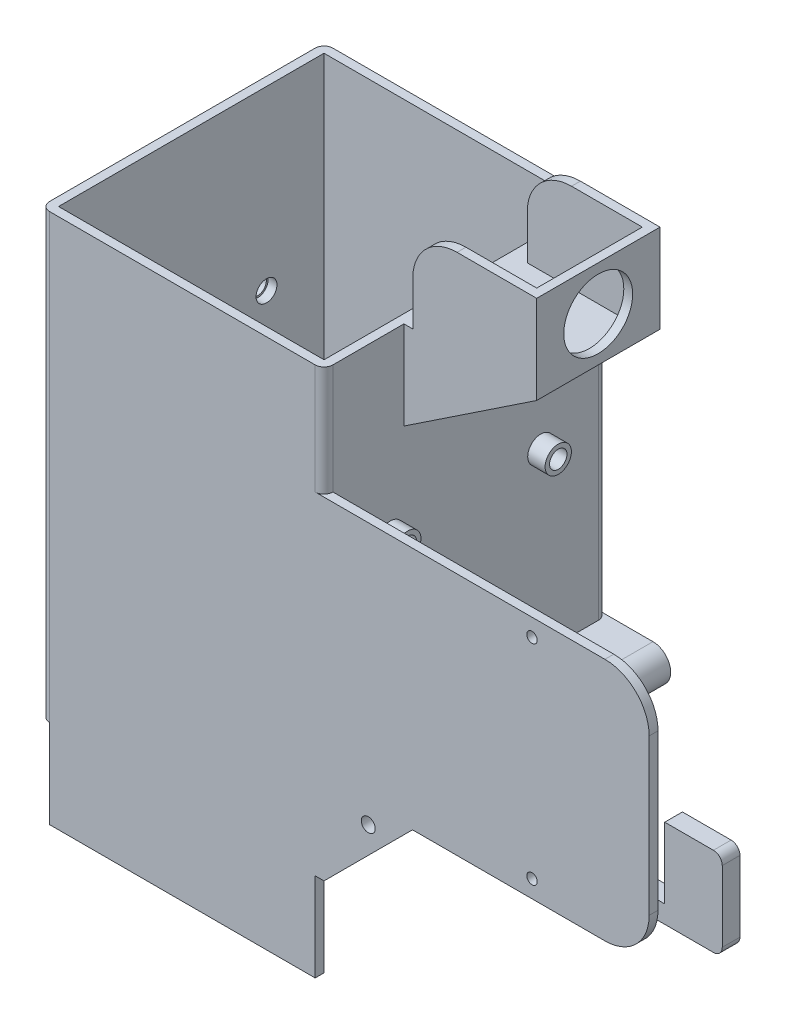
from build123d import *

# Parameters (mm, degrees)
SKETCH1_W            = 81.28
SKETCH1_H            = 81.28
SKETCH1_W_2          = 76.2
SKETCH1_H_2          = 76.2
BOSS_EXTRUDE1_DEPTH  = 177.8
SKETCH2_W            = 2.54
SKETCH2_H            = 38.1
BOSS_EXTRUDE2_DEPTH  = 25.4
SKETCH3_W            = 2.54
SKETCH3_H            = 25.4
CUT_EXTRUDE1_DEPTH   = 212.720846399
BOSS_EXTRUDE3_DEPTH  = 12.7
BOSS_EXTRUDE4_DEPTH  = 12.7
SKETCH14_W           = 5.08
SKETCH14_H           = 25.4
BOSS_EXTRUDE6_DEPTH  = 76.2
CUT_EXTRUDE2_REACH   = 243.407
SKETCH16_W           = 23.13
SKETCH16_H           = 20.32
SKETCH22_R           = 2
CUT_EXTRUDE6_DEPTH   = 252.036309724
SKETCH28_W           = 35.399999812
SKETCH28_H           = 50.8
BOSS_EXTRUDE7_DEPTH  = 38.1
CUT_EXTRUDE8_REACH   = 246.574
SKETCH32_W           = 33.02
SKETCH32_H           = 30.319999812
CUT_EXTRUDE9_DEPTH   = 25.4
CUT_EXTRUDE13_REACH  = 245.27
SKETCH34_R           = 9.890000016
BOSS_EXTRUDE9_DEPTH  = 2.54
SKETCH38_W           = 2.54
SKETCH38_H           = 25.4
CUT_EXTRUDE15_DEPTH  = 63.5
CUT_EXTRUDE17_REACH  = 224.71
SKETCH40_R           = 2.999995
SKETCH41_R           = 3.77
SKETCH41_R_2         = 2.5
BOSS_EXTRUDE10_DEPTH = 5
BOSS_EXTRUDE11_START = 5
SKETCH42_R           = 3.77
SKETCH42_R_2         = 2.5
BOSS_EXTRUDE11_DEPTH = 5
SKETCH43_W           = 76.2
SKETCH43_H           = 76.2
CUT_EXTRUDE20_DEPTH  = 25.4
SKETCH44_W           = 174.6
SKETCH44_H           = 70
SKETCH44_R           = 1.5
BOSS_EXTRUDE12_DEPTH = 2.54
FILLET1_R            = 5.08
FILLET2_R            = 12.7
FILLET3_R            = 2.54
FILLET7_R            = 12.7
FILLET9_R            = 12.7
BOSS_EXTRUDE20_DEPTH = 88.9
CUT_EXTRUDE21_REACH  = 275.109
SKETCH54_R           = 2.5
FILLET11_R           = 2.54
FILLET12_R           = 2.54


with BuildPart() as part:
    # Sketch1 → Boss-Extrude1 (new body)
    with BuildSketch(Plane(origin=(0, 0, 0), x_dir=(1, 0, 0), z_dir=(0, 1, 0))):
        with Locations((40.64, 40.64)):
            Rectangle(SKETCH1_W, SKETCH1_H)
        with Locations((40.64, 40.64)):
            Rectangle(SKETCH1_W_2, SKETCH1_H_2, mode=Mode.SUBTRACT)
    extrude(amount=BOSS_EXTRUDE1_DEPTH)

    # Sketch2 → Boss-Extrude2 (add)
    with BuildSketch(Plane(origin=(0, 0, 0), x_dir=(0, 0, -1), z_dir=(1, 0, 0))):
        with Locations((64.77, 19.05)):
            Rectangle(SKETCH2_W, SKETCH2_H)
    extrude(amount=-BOSS_EXTRUDE2_DEPTH)

    # Sketch3 → Cut-Extrude1 (cut, through all)
    with BuildSketch(Plane.XY):
        with Locations((80.01, 12.7)):
            Rectangle(SKETCH3_W, SKETCH3_H)
    extrude(amount=-CUT_EXTRUDE1_DEPTH, mode=Mode.SUBTRACT)

    # Sketch7 → Boss-Extrude3 (add)
    with BuildSketch(Plane.XY):
        Polygon((81.28, 25.4), (106.68, 50.8), (81.28, 50.8), align=None)
    extrude(amount=-BOSS_EXTRUDE3_DEPTH)

    # Sketch10 → Boss-Extrude4 (add)
    with BuildSketch(Plane(origin=(0, 0, -81.28), x_dir=(-1, 0, 0), z_dir=(0, 0, -1))):
        Polygon((-81.28, 25.4), (-81.28, 50.8), (-106.68, 50.8), align=None)
    extrude(amount=-BOSS_EXTRUDE4_DEPTH)

    # Sketch14 → Boss-Extrude6 (add)
    with BuildSketch(Plane(origin=(81.28, 0, 0), x_dir=(0, 0, -1), z_dir=(1, 0, 0))):
        with Locations((40.64, 38.1)):
            Rectangle(SKETCH14_W, SKETCH14_H)
    extrude(amount=BOSS_EXTRUDE6_DEPTH)

    # Sketch16 → Cut-Extrude2 (cut, up to next)
    with BuildSketch(Plane.XY.offset(-38.1), mode=Mode.PRIVATE) as cut_extrude2_sk1:
        with Locations((129.405, 40.64)):
            Rectangle(SKETCH16_W, SKETCH16_H)
    cut_extrude2_tool1 = extrude(cut_extrude2_sk1.sketch, amount=-CUT_EXTRUDE2_REACH, mode=Mode.PRIVATE) & part.part
    add(cut_extrude2_tool1.solids().sort_by_distance((129.405, 40.64, -38.1))[0], mode=Mode.SUBTRACT)

    # Sketch22 → Cut-Extrude6 (cut, through all)
    with BuildSketch(Plane.XY):
        with Locations((93.98, 45.72)):
            Circle(SKETCH22_R)
    extrude(amount=-CUT_EXTRUDE6_DEPTH, mode=Mode.SUBTRACT)

    # Sketch28 → Boss-Extrude7 (add)
    with BuildSketch(Plane(origin=(81.28, 0, 0), x_dir=(0, 0, -1), z_dir=(1, 0, 0))):
        with Locations((40.64, 152.4)):
            Rectangle(SKETCH28_W, SKETCH28_H)
    extrude(amount=BOSS_EXTRUDE7_DEPTH)

    # Sketch30 → Cut-Extrude8 (cut, up to next)
    with BuildSketch(Plane.XY.offset(-22.940000094), mode=Mode.PRIVATE) as cut_extrude8_sk1:
        Polygon((81.28, 127), (119.38, 127), (119.38, 152.4), align=None)
    cut_extrude8_tool1 = extrude(cut_extrude8_sk1.sketch, amount=-CUT_EXTRUDE8_REACH, mode=Mode.PRIVATE) & part.part
    add(cut_extrude8_tool1.solids().sort_by_distance((106.68, 135.466667, -22.94))[0], mode=Mode.SUBTRACT)

    # Sketch32 → Cut-Extrude9 (cut)
    with BuildSketch(Plane(origin=(0, 177.8, 0), x_dir=(1, 0, 0), z_dir=(0, 1, 0))):
        with Locations((100.33, 40.64)):
            Rectangle(SKETCH32_W, SKETCH32_H)
    extrude(amount=-CUT_EXTRUDE9_DEPTH, mode=Mode.SUBTRACT)

    # Cut-Extrude13: up to this face of the body (flat: up to its plane)
    cut_extrude13_end = Plane(part.part.faces().sort_by_distance((78.74, 101.6, -40.64))[0])
    # Sketch34 → Cut-Extrude13 (cut, up to the picked face)
    with BuildSketch(Plane(origin=(119.38, 0, 0), x_dir=(0, 0, -1), z_dir=(1, 0, 0)), mode=Mode.PRIVATE) as cut_extrude13_sk1:
        with Locations(Location((40.593000094, 165.1, 0), (0, 0, 180))):
            Circle(SKETCH34_R)
    cut_extrude13_tool1 = split(extrude(cut_extrude13_sk1.sketch, amount=-CUT_EXTRUDE13_REACH, mode=Mode.PRIVATE), bisect_by=cut_extrude13_end, keep=Keep.BOTH, mode=Mode.PRIVATE)
    add(cut_extrude13_tool1.solids().sort_by(Axis((119.38, 165.1, -40.593), (-1, 0, 0)))[0], mode=Mode.SUBTRACT)

    # Sketch37 → Boss-Extrude9 (add)
    with BuildSketch(Plane.XY.offset(-63.5)):
        Polygon((-25.4, 38.1), (0, 38.1), (0, 52.764696837), align=None)
    extrude(amount=-BOSS_EXTRUDE9_DEPTH)

    # Sketch38 → Cut-Extrude15 (cut)
    with BuildSketch(Plane.XY):
        with Locations((1.27, 12.7)):
            Rectangle(SKETCH38_W, SKETCH38_H)
    extrude(amount=-CUT_EXTRUDE15_DEPTH, mode=Mode.SUBTRACT)

    # Cut-Extrude17: up to this face of the body (flat: up to its plane)
    cut_extrude17_end = Plane(part.part.faces().sort_by_distance((0, 99.23335202, -41.514066738))[0])
    # Sketch40 → Cut-Extrude17 (cut, up to the picked face)
    with BuildSketch(Plane(origin=(81.28, 0, 0), x_dir=(0, 0, -1), z_dir=(1, 0, 0)), mode=Mode.PRIVATE) as cut_extrude17_sk1:
        with Locations((19.05, 101.6)):
            Circle(SKETCH40_R)
    cut_extrude17_tool1 = split(extrude(cut_extrude17_sk1.sketch, amount=-CUT_EXTRUDE17_REACH, mode=Mode.PRIVATE), bisect_by=cut_extrude17_end, keep=Keep.BOTH, mode=Mode.PRIVATE)
    # Sketch40 → Cut-Extrude17 (cut, up to the picked face)
    with BuildSketch(Plane(origin=(81.28, 0, 0), x_dir=(0, 0, -1), z_dir=(1, 0, 0)), mode=Mode.PRIVATE) as cut_extrude17_sk2:
        with Locations((62.23, 101.6)):
            Circle(SKETCH40_R)
    cut_extrude17_tool2 = split(extrude(cut_extrude17_sk2.sketch, amount=-CUT_EXTRUDE17_REACH, mode=Mode.PRIVATE), bisect_by=cut_extrude17_end, keep=Keep.BOTH, mode=Mode.PRIVATE)
    add(cut_extrude17_tool1.solids().sort_by(Axis((81.28, 101.6, -19.05), (-1, 0, 0)))[0], mode=Mode.SUBTRACT)
    add(cut_extrude17_tool2.solids().sort_by(Axis((81.28, 101.6, -62.23), (-1, 0, 0)))[0], mode=Mode.SUBTRACT)

    # Sketch41 → Boss-Extrude10 (add)
    # profile 1 of 2: a face of its own
    with BuildSketch(Plane(origin=(81.28, 0, 0), x_dir=(0, 0, -1), z_dir=(1, 0, 0))):
        with Locations(Location((19.05, 101.6, 0), (0, 0, 180))):
            Circle(SKETCH41_R)
        with Locations((19.05, 101.6)):
            Circle(SKETCH41_R_2, mode=Mode.SUBTRACT)
    # profile 2 of 2: a face of its own
    with BuildSketch(Plane(origin=(81.28, 0, 0), x_dir=(0, 0, -1), z_dir=(1, 0, 0))):
        with Locations(Location((62.23, 101.6, 0), (0, 0, 180))):
            Circle(SKETCH41_R)
        with Locations((62.23, 101.6)):
            Circle(SKETCH41_R_2, mode=Mode.SUBTRACT)
    extrude(amount=BOSS_EXTRUDE10_DEPTH)

    # Sketch42 → Boss-Extrude11 (add)
    # profile 1 of 2: a face of its own
    with BuildSketch(Plane.ZY.offset(BOSS_EXTRUDE11_START)):
        with Locations((-62.23, 101.6)):
            Circle(SKETCH42_R)
        with Locations(Location((-62.23, 101.6, 0), (0, 0, 180))):
            Circle(SKETCH42_R_2, mode=Mode.SUBTRACT)
    # profile 2 of 2: a face of its own
    with BuildSketch(Plane.ZY.offset(BOSS_EXTRUDE11_START)):
        with Locations((-19.05, 101.6)):
            Circle(SKETCH42_R)
        with Locations(Location((-19.05, 101.6, 0), (0, 0, 180))):
            Circle(SKETCH42_R_2, mode=Mode.SUBTRACT)
    extrude(amount=-BOSS_EXTRUDE11_DEPTH)

    # Sketch43 → Cut-Extrude20 (cut)
    with BuildSketch(Plane(origin=(0, 177.8, 0), x_dir=(1, 0, 0), z_dir=(0, 1, 0))):
        Polygon((83.82, 58.339999906), (83.82, 22.940000094), (81.28, 22.940000094), (81.28, 0), (0, 0), (0, 81.28), (81.28, 81.28), (81.28, 58.339999906), align=None)
        with Locations((40.64, 40.64)):
            Rectangle(SKETCH43_W, SKETCH43_H, mode=Mode.SUBTRACT)
    extrude(amount=-CUT_EXTRUDE20_DEPTH, mode=Mode.SUBTRACT)

    # Sketch44 → Boss-Extrude12 (add)
    with BuildSketch(Plane.XY):
        with Locations((87.3, 85.8)):
            Rectangle(SKETCH44_W, SKETCH44_H)
        with Locations((140.97, 115.8)):
            Circle(SKETCH44_R, mode=Mode.SUBTRACT)
        with Locations((140.97, 55.8)):
            Circle(SKETCH44_R, mode=Mode.SUBTRACT)
    extrude(amount=-BOSS_EXTRUDE12_DEPTH)

    # Fillet1
    fillet1_edges = [part.edges().sort_by_distance(p)[0] for p in [
        (106.68, 50.8, -7.62),
        (106.68, 50.8, -74.93),
    ]]
    fillet(fillet1_edges, radius=FILLET1_R)

    # Fillet2
    fillet2_edges = [part.edges().sort_by_distance(p)[0] for p in [
        (174.6, 120.8, -1.27),
        (174.6, 50.8, -1.27),
    ]]
    fillet(fillet2_edges, radius=FILLET2_R)

    # Fillet3
    fillet3_edges = [part.edges().sort_by_distance(p)[0] for p in [
        (157.48, 50.8, -40.64),
        (157.48, 25.4, -40.64),
    ]]
    fillet(fillet3_edges, radius=FILLET3_R)

    # Fillet7
    fillet7_edges = [part.edges().sort_by_distance(p)[0] for p in [
        (-25.4, 38.1, -64.77),
    ]]
    fillet(fillet7_edges, radius=FILLET7_R)

    # Fillet9
    fillet9_edges = [part.edges().sort_by_distance(p)[0] for p in [
        (83.82, 177.8, -24.210000094),
        (83.82, 177.8, -57.069999906),
    ]]
    fillet(fillet9_edges, radius=FILLET9_R)

    # Sketch53 → Boss-Extrude20 (add)
    with BuildSketch(Plane(origin=(0, 0, 0), x_dir=(-1, 0, 0), z_dir=(0, -1, 0))):
        Polygon((-35.659105782, 81.28), (-35.659105782, 78.74), (-45.72, 78.74), (-45.72, 111.76), (-15.24, 111.76), (-15.24, 106.68), (-40.64, 106.68), (-40.64, 81.28), align=None)
    extrude(amount=-BOSS_EXTRUDE20_DEPTH)

    # Sketch54 → Cut-Extrude21 (cut, up to next)
    with BuildSketch(Plane(origin=(0, 0, -111.76), x_dir=(-1, 0, 0), z_dir=(0, 0, -1)), mode=Mode.PRIVATE) as cut_extrude21_sk1:
        with Locations((-30.48, 76.2)):
            Circle(SKETCH54_R)
    cut_extrude21_tool1 = extrude(cut_extrude21_sk1.sketch, amount=-CUT_EXTRUDE21_REACH, mode=Mode.PRIVATE) & part.part
    # Sketch54 → Cut-Extrude21 (cut, up to next)
    with BuildSketch(Plane(origin=(0, 0, -111.76), x_dir=(-1, 0, 0), z_dir=(0, 0, -1)), mode=Mode.PRIVATE) as cut_extrude21_sk2:
        with Locations((-30.48, 44.45)):
            Circle(SKETCH54_R)
    cut_extrude21_tool2 = extrude(cut_extrude21_sk2.sketch, amount=-CUT_EXTRUDE21_REACH, mode=Mode.PRIVATE) & part.part
    # Sketch54 → Cut-Extrude21 (cut, up to next)
    with BuildSketch(Plane(origin=(0, 0, -111.76), x_dir=(-1, 0, 0), z_dir=(0, 0, -1)), mode=Mode.PRIVATE) as cut_extrude21_sk3:
        with Locations((-30.48, 12.7)):
            Circle(SKETCH54_R)
    cut_extrude21_tool3 = extrude(cut_extrude21_sk3.sketch, amount=-CUT_EXTRUDE21_REACH, mode=Mode.PRIVATE) & part.part
    add(cut_extrude21_tool1.solids().sort_by_distance((30.48, 76.2, -111.76))[0], mode=Mode.SUBTRACT)
    add(cut_extrude21_tool2.solids().sort_by_distance((30.48, 44.45, -111.76))[0], mode=Mode.SUBTRACT)
    add(cut_extrude21_tool3.solids().sort_by_distance((30.48, 12.7, -111.76))[0], mode=Mode.SUBTRACT)

    # Fillet11
    fillet11_edges = [part.edges().sort_by_distance(p)[0] for p in [
        (15.24, 0, -109.22),
        (15.24, 88.9, -109.22),
        (15.24, 44.45, -111.76),
        (15.24, 44.45, -106.68),
    ]]
    fillet(fillet11_edges, radius=FILLET11_R - 0.0001)  # a hair under: the kernel refuses the full size

    # Fillet12
    fillet12_edges = [part.edges().sort_by_distance(p)[0] for p in [
        (81.28, 136.6, 0),
        (81.28, 101.6, -81.28),
        (0, 76.2, -81.28),
        (0, 88.9, 0),
    ]]
    fillet(fillet12_edges, radius=FILLET12_R)


solid = part.part
